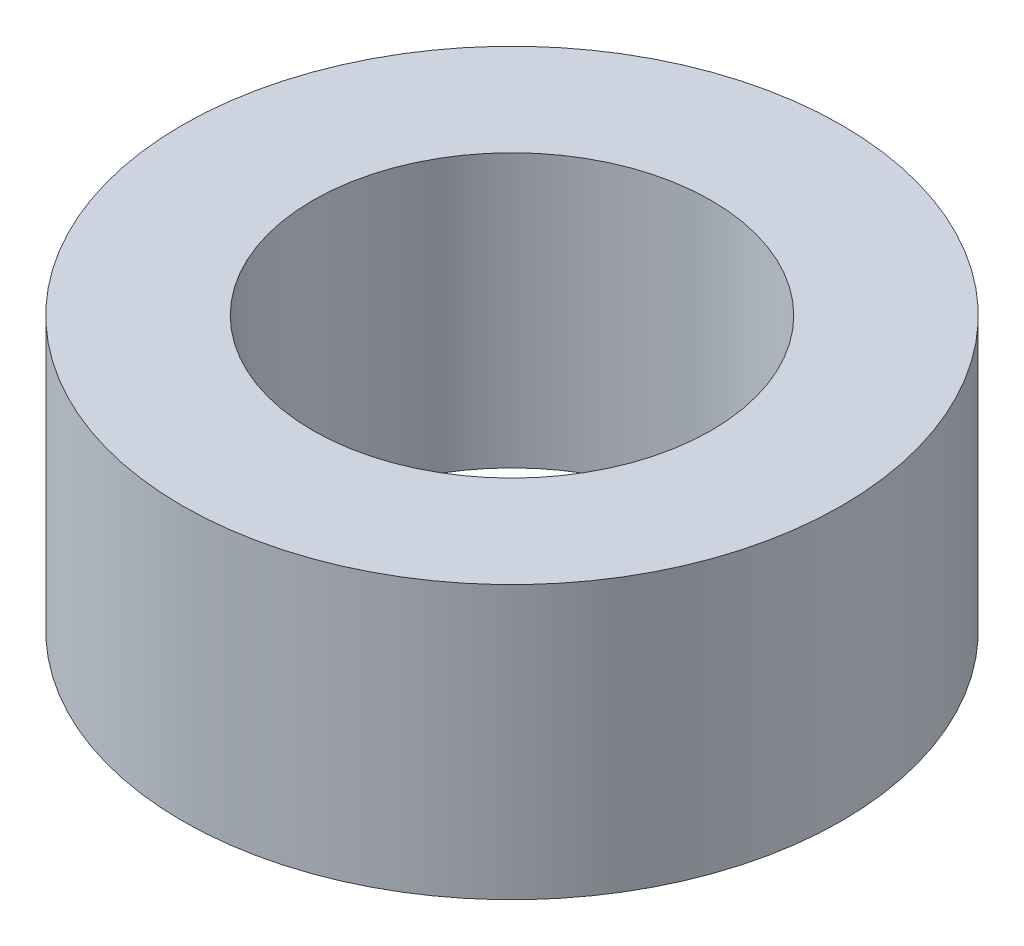
from build123d import *

# Parameters (mm, degrees)
SKETCH1_R           = 22.5
BOSS_EXTRUDE1_DEPTH = 18.624368903
SKETCH2_R           = 13.597266194
CUT_EXTRUDE1_DEPTH  = 37.869596106


with BuildPart() as part:
    # Sketch1 → Boss-Extrude1 (new body)
    with BuildSketch(Plane(origin=(0, 0, 0), x_dir=(1, 0, 0), z_dir=(0, 1, 0))):
        Circle(SKETCH1_R)
    extrude(amount=BOSS_EXTRUDE1_DEPTH)

    # Sketch2 → Cut-Extrude1 (cut, through all)
    with BuildSketch(Plane(origin=(0, 0, 0), x_dir=(1, 0, 0), z_dir=(0, 1, 0))):
        Circle(SKETCH2_R)
    extrude(amount=CUT_EXTRUDE1_DEPTH, mode=Mode.SUBTRACT)


solid = part.part
